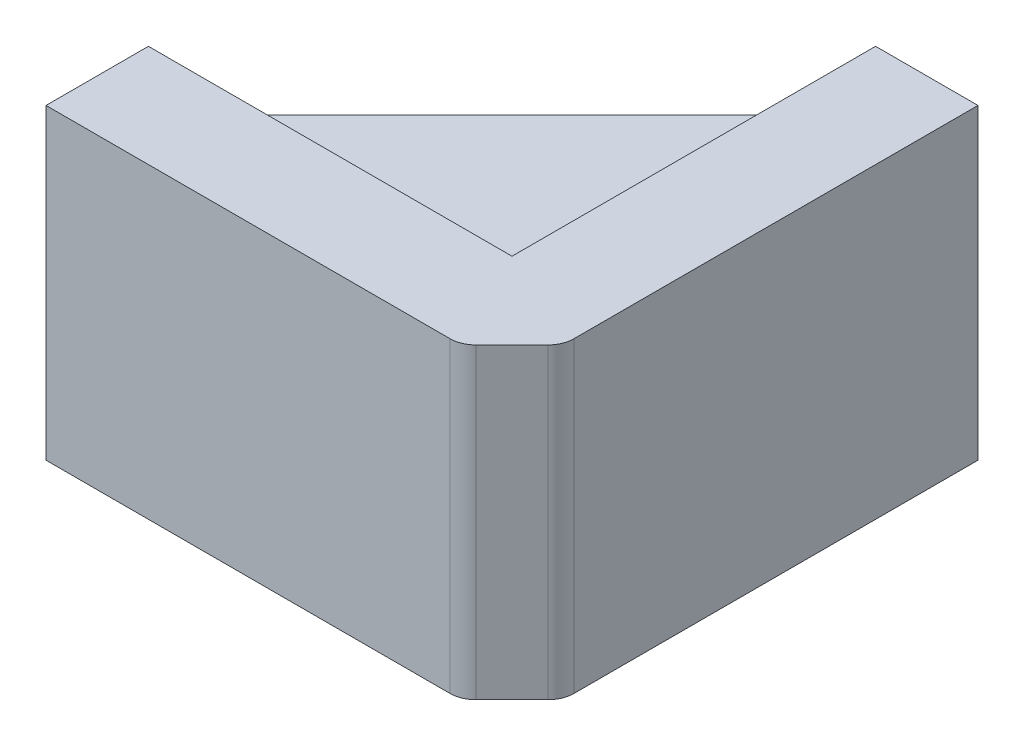
from build123d import *

# Parameters (mm, degrees)
BOSS_EXTRUDE1_DEPTH = 60
CHAMFER1_SIZE       = 10
FILLET1_R           = 5
BOSS_EXTRUDE2_START = -4.4
BOSS_EXTRUDE2_DEPTH = 5


with BuildPart() as part:
    # Sketch1 → Boss-Extrude1 (new body)
    with BuildSketch(Plane(origin=(0, 0, 0), x_dir=(1, 0, 0), z_dir=(0, 1, 0))):
        Polygon((25.5, 45.5), (25.5, -25.5), (-45.5, -25.5), (-45.5, -45.5), (45.5, -45.5), (45.5, 45.5), align=None)
    extrude(amount=BOSS_EXTRUDE1_DEPTH)

    # Chamfer1
    chamfer1_edges = [part.edges().sort_by_distance(p)[0] for p in [
        (45.5, 30, 45.5),
    ]]
    chamfer(chamfer1_edges, length=CHAMFER1_SIZE)

    # Fillet1
    fillet1_edges = [part.edges().sort_by_distance(p)[0] for p in [
        (45.5, 30, 35.5),
        (35.5, 30, 45.5),
    ]]
    fillet(fillet1_edges, radius=FILLET1_R)

    # Sketch2 → Boss-Extrude2 (add)
    with BuildSketch(Plane(origin=(0, 60, 0), x_dir=(1, 0, 0), z_dir=(0, 1, 0)).offset(BOSS_EXTRUDE2_START)):
        Polygon((25.5, 31.068542495), (-31.068542495, -25.5), (25.5, -25.5), align=None)
    extrude(amount=-BOSS_EXTRUDE2_DEPTH)


solid = part.part
